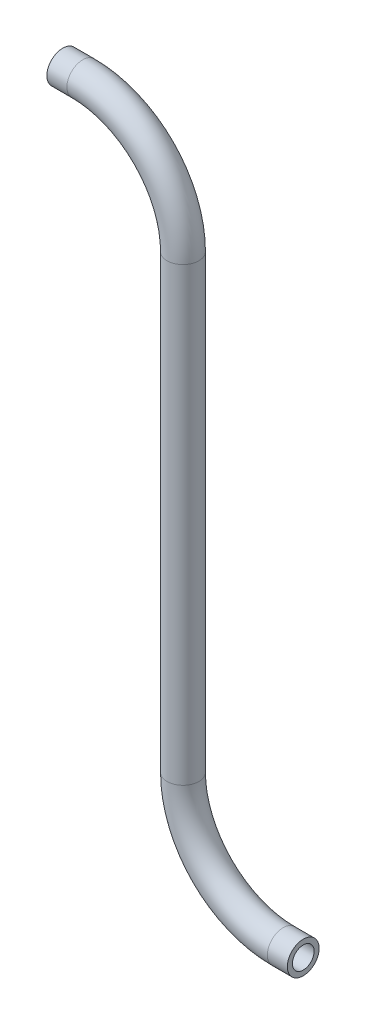
from build123d import *

# Parameters (mm, degrees)
SWEEP_SOTTILE1_PROFILE_R   = 1.585
SWEEP_SOTTILE1_PROFILE_R_2 = 1.085


with BuildPart() as part:
    # Sweep-Sottile1: sweep along a path in Schizzo1
    with BuildLine(Plane.XY) as sweep_sottile1_path:
        Line((-12, 65), (-10, 65))
        ThreePointArc((-10, 65), (-2.928932188, 62.071067812), (0, 55))
        Line((0, 55), (0, 10))
        ThreePointArc((0, 10), (2.928932188, 2.928932188), (10, 0))
        Line((10, 0), (12, 0))
    # Sweep-Sottile1 profile (on start of the path) → Sweep-Sottile1 (sweep)
    with BuildSketch(Plane(origin=(-12, 65, 0), x_dir=(0, 0, 1), z_dir=(1, 0, 0))):
        Circle(SWEEP_SOTTILE1_PROFILE_R)
        Circle(SWEEP_SOTTILE1_PROFILE_R_2, mode=Mode.SUBTRACT)
    sweep(path=sweep_sottile1_path.line)


solid = part.part
